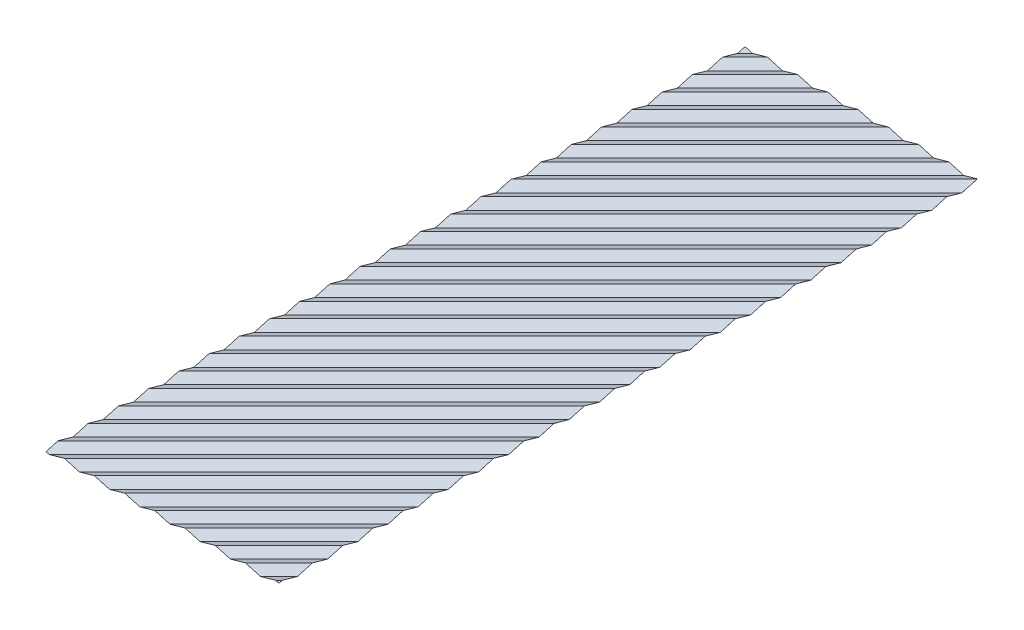
from build123d import *

# Parameters (mm, degrees)
EXTRUDE_THIN1_DEPTH     = 1205.592
LPATTERN1_COUNT         = 31
LPATTERN1_PITCH         = 55.88
CUT_EXTRUDE1_DEPTH      = 2076.581669694
CUT_EXTRUDE1_DEPTH_BACK = 2076.581669694
SKETCH2_OUTSIDE_W       = 3760.584
SKETCH2_OUTSIDE_H       = 3760.584
SKETCH2_OUTSIDE_W_2     = 609.6
SKETCH2_OUTSIDE_H_2     = 1828.8


with BuildPart() as part:
    # Sketch1 → Extrude-Thin1 (new, symmetric)
    with BuildSketch(Plane(origin=(0, 0, 0), x_dir=(-0.7071067811865477, 0, -0.7071067811865475), z_dir=(0.7071067811865475, 0, -0.7071067811865477))):
        Polygon((-869.940566677, 5.564416692), (-855.98, 11.148643363), (-842.019433323, 5.564416692), (-828.04, -0.027356637), (-814.060566677, 5.564416692), (-814.079433323, 5.611583308), (-828.04, 0.027356637), (-842.000566677, 5.611583308), (-855.98, 11.203356637), (-869.959433323, 5.611583308), align=None)
    extrude_thin1 = extrude(amount=EXTRUDE_THIN1_DEPTH, both=True)

    # LPattern1: Extrude-Thin1 ×31
    with Locations(*[Vector(-0.7071067811865477, 0, -0.7071067811865475) * (i * LPATTERN1_PITCH) for i in range(1, LPATTERN1_COUNT)]):
        add(extrude_thin1)

    # Sketch2 outside → Cut-Extrude1 (cut, two sides: drawn at the far end of the back side and taken through both)
    with BuildSketch(Plane(origin=(0, 0, 0), x_dir=(1, 0, 0), z_dir=(0, 1, 0)).offset(-CUT_EXTRUDE1_DEPTH_BACK)):
        with Locations((2.694, -2.694)):
            Rectangle(SKETCH2_OUTSIDE_W, SKETCH2_OUTSIDE_H)
        Rectangle(SKETCH2_OUTSIDE_W_2, SKETCH2_OUTSIDE_H_2, mode=Mode.SUBTRACT)
    extrude(amount=CUT_EXTRUDE1_DEPTH + CUT_EXTRUDE1_DEPTH_BACK, mode=Mode.SUBTRACT)


solid = part.part
